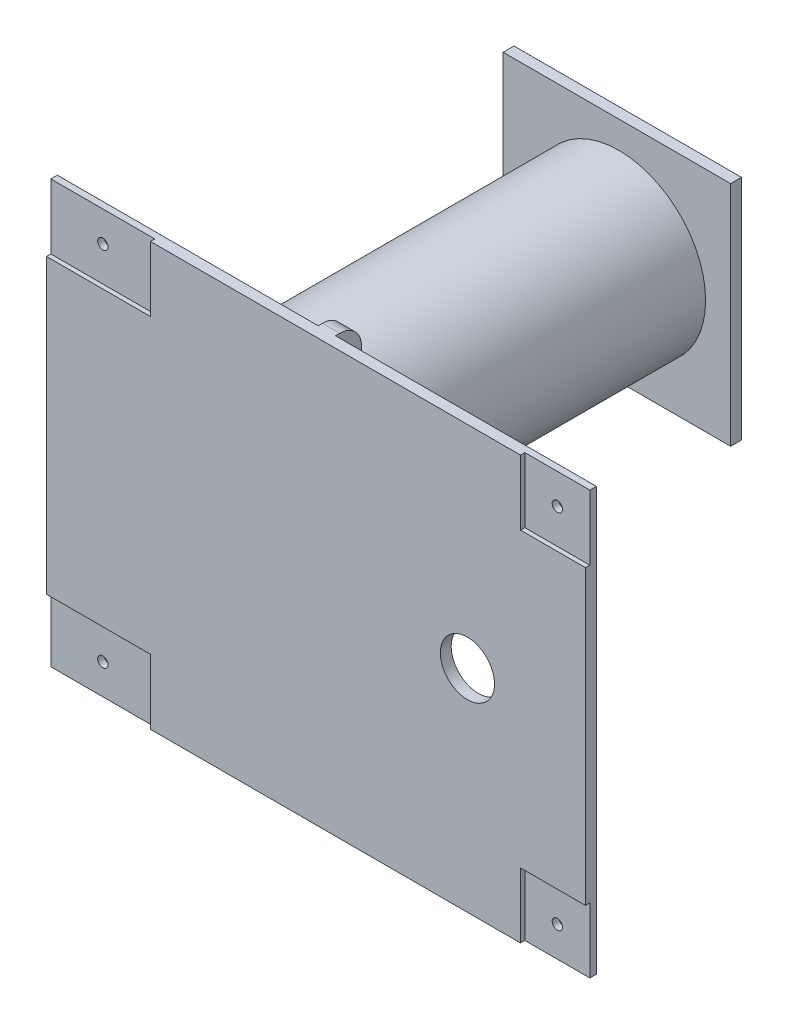
from build123d import *

# Parameters (mm, degrees)
CROQUIS1_W                 = 248.76
CROQUIS1_H                 = 195
SALIENTE_EXTRUIR1_DEPTH    = 5
CROQUIS2_W                 = 48
CROQUIS2_H                 = 30
CROQUIS2_W_2               = 30
CORTAR_EXTRUIR1_DEPTH      = 2
CROQUIS3_R                 = 2.375
CORTAR_EXTRUIR2_DEPTH      = 10
CROQUIS4_R                 = 40
SALIENTE_EXTRUIR2_DEPTH    = 197
CROQUIS5_R                 = 12.5
CORTAR_EXTRUIR3_DEPTH      = 10
CROQUIS12_W                = 12
CROQUIS12_H                = 30
SALIENTE_EXTRUIR3_DEPTH    = 4
REDONDEO1_R                = 10
REDONDEO2_R                = 10
REDONDEO3_R                = 10
CORTAR_EXTRUIR5_DEPTH      = 255.652637961
CORTAR_EXTRUIR5_DEPTH_BACK = 255.652637961
CROQUIS13_R                = 1.625
CROQUIS16_W                = 105
CROQUIS16_H                = 105
SALIENTE_EXTRUIR4_DEPTH    = 5


with BuildPart() as part:
    # Croquis1 → Saliente-Extruir1 (new body)
    with BuildSketch(Plane.XY):
        with Locations((7.088293187, 0.26268)):
            Rectangle(CROQUIS1_W, CROQUIS1_H)
    extrude(amount=SALIENTE_EXTRUIR1_DEPTH)

    # Croquis2 → Cortar-Extruir1 (cut)
    with BuildSketch(Plane.XY.offset(5)):
        with Locations((-93.291706813, -82.23732)):
            Rectangle(CROQUIS2_W, CROQUIS2_H)
        with Locations((116.468293187, 82.76268)):
            Rectangle(CROQUIS2_W_2, CROQUIS2_H)
        with Locations((116.468293187, -82.23732)):
            Rectangle(CROQUIS2_W_2, CROQUIS2_H)
        with Locations((-93.291706813, 82.76268)):
            Rectangle(CROQUIS2_W, CROQUIS2_H)
    extrude(amount=-CORTAR_EXTRUIR1_DEPTH, mode=Mode.SUBTRACT)

    # Croquis3 → Cortar-Extruir2 (cut)
    with BuildSketch(Plane.XY.offset(5)):
        with Locations((-93.291706813, 83.76268)):
            Circle(CROQUIS3_R)
        with Locations((-93.291706813, -83.23732)):
            Circle(CROQUIS3_R)
        with Locations((116.468293187, 83.76268)):
            Circle(CROQUIS3_R)
        with Locations((116.468293187, -83.23732)):
            Circle(CROQUIS3_R)
    extrude(amount=-CORTAR_EXTRUIR2_DEPTH, mode=Mode.SUBTRACT)

    # Croquis4 → Saliente-Extruir2 (add)
    with BuildSketch(Plane(origin=(0, 0, 0), x_dir=(-1, 0, 0), z_dir=(0, 0, -1))):
        with Locations((55.101706813, 0.26268)):
            Circle(CROQUIS4_R)
    extrude(amount=SALIENTE_EXTRUIR2_DEPTH)

    # Croquis5 → Cortar-Extruir3 (cut)
    with BuildSketch(Plane(origin=(0, 0, 0), x_dir=(-1, 0, 0), z_dir=(0, 0, -1))):
        with Locations((-76.968293187, 0.26268)):
            Circle(CROQUIS5_R)
    extrude(amount=-CORTAR_EXTRUIR3_DEPTH, mode=Mode.SUBTRACT)

    # Croquis12 → Saliente-Extruir3 (add, symmetric)
    with BuildSketch(Plane(origin=(7.088293187, 0, 0), x_dir=(0, 0, -1), z_dir=(1, 0, 0))):
        with Locations((6, 82.76268)):
            Rectangle(CROQUIS12_W, CROQUIS12_H)
        with Locations((6, -82.23732)):
            Rectangle(CROQUIS12_W, CROQUIS12_H)
    extrude(amount=SALIENTE_EXTRUIR3_DEPTH, both=True)

    # Redondeo1
    redondeo1_edges = [part.edges().sort_by_distance(p)[0] for p in [
        (7.088293187, -67.23732, 0),
        (7.088293187, 67.76268, 0),
    ]]
    fillet(redondeo1_edges, radius=REDONDEO1_R)

    # Redondeo2
    redondeo2_edges = [part.edges().sort_by_distance(p)[0] for p in [
        (7.088293187, 67.76268, -12),
        (7.088293187, -67.23732, -12),
    ]]
    fillet(redondeo2_edges, radius=REDONDEO2_R)

    # Redondeo3
    redondeo3_edges = [part.edges().sort_by_distance(p)[0] for p in [
        (7.088293187, -97.23732, -12),
        (7.088293187, 97.76268, -12),
    ]]
    fillet(redondeo3_edges, radius=REDONDEO3_R)

    # Croquis13 → Cortar-Extruir5 (cut, two sides: drawn at the far end of the back side and taken through both)
    with BuildSketch(Plane(origin=(11.088293187, 0, 0), x_dir=(0, 0, -1), z_dir=(1, 0, 0)).offset(-CORTAR_EXTRUIR5_DEPTH_BACK)):
        with Locations((6, 87.76268)):
            Circle(CROQUIS13_R)
        with Locations((6, 77.76268)):
            Circle(CROQUIS13_R)
        with Locations((6, -77.23732)):
            Circle(CROQUIS13_R)
        with Locations((6, -87.23732)):
            Circle(CROQUIS13_R)
    extrude(amount=CORTAR_EXTRUIR5_DEPTH + CORTAR_EXTRUIR5_DEPTH_BACK, mode=Mode.SUBTRACT)

    # Croquis16 → Saliente-Extruir4 (add)
    with BuildSketch(Plane(origin=(0, 0, -197), x_dir=(-1, 0, 0), z_dir=(0, 0, -1))):
        with Locations((56.031706813, 0.26268)):
            Rectangle(CROQUIS16_W, CROQUIS16_H)
    extrude(amount=SALIENTE_EXTRUIR4_DEPTH)


solid = part.part
